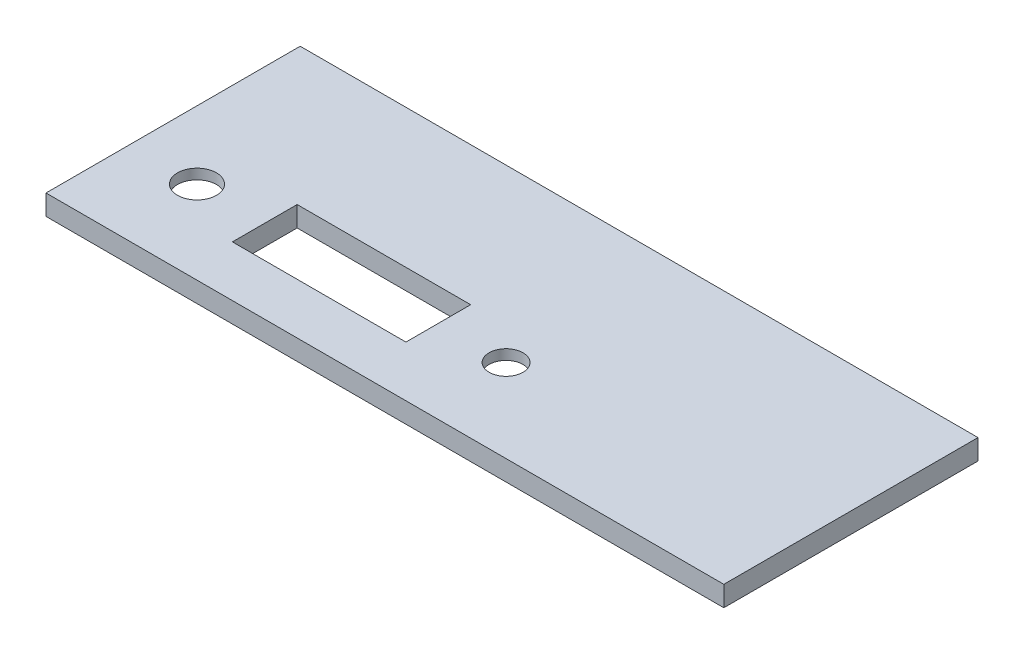
from build123d import *

# Parameters (mm, degrees)
SKETCH1_W           = 200
SKETCH1_H           = 75
BOSS_EXTRUDE1_DEPTH = 6
SKETCH2_R           = 5.75
SKETCH2_R_2         = 5
SKETCH2_W           = 51.2
SKETCH2_H           = 19.1
CUT_EXTRUDE1_DEPTH  = 214.684346642
SKETCH3_R           = 10
CUT_EXTRUDE2_DEPTH  = 3
SKETCH4_R           = 10
CUT_EXTRUDE3_DEPTH  = 3


with BuildPart() as part:
    # Sketch1 → Boss-Extrude1 (new body)
    with BuildSketch(Plane(origin=(0, 0, 0), x_dir=(1, 0, 0), z_dir=(0, 1, 0))):
        with Locations((100, 37.5)):
            Rectangle(SKETCH1_W, SKETCH1_H)
    extrude(amount=BOSS_EXTRUDE1_DEPTH)

    # Sketch2 → Cut-Extrude1 (cut, through all)
    with BuildSketch(Plane(origin=(0, 6, 0), x_dir=(1, 0, 0), z_dir=(0, 1, 0))):
        with Locations((20, 24.55)):
            Circle(SKETCH2_R)
        with Locations((111.2, 24.55)):
            Circle(SKETCH2_R_2)
        with Locations((65.6, 24.55)):
            Rectangle(SKETCH2_W, SKETCH2_H)
    extrude(amount=-CUT_EXTRUDE1_DEPTH, mode=Mode.SUBTRACT)

    # Sketch3 → Cut-Extrude2 (cut)
    with BuildSketch(Plane.XZ):
        with Locations((20, -24.55)):
            Circle(SKETCH3_R)
    extrude(amount=-CUT_EXTRUDE2_DEPTH, mode=Mode.SUBTRACT)

    # Sketch4 → Cut-Extrude3 (cut)
    with BuildSketch(Plane.XZ):
        with Locations((111.2, -24.55)):
            Circle(SKETCH4_R)
    extrude(amount=-CUT_EXTRUDE3_DEPTH, mode=Mode.SUBTRACT)


solid = part.part
